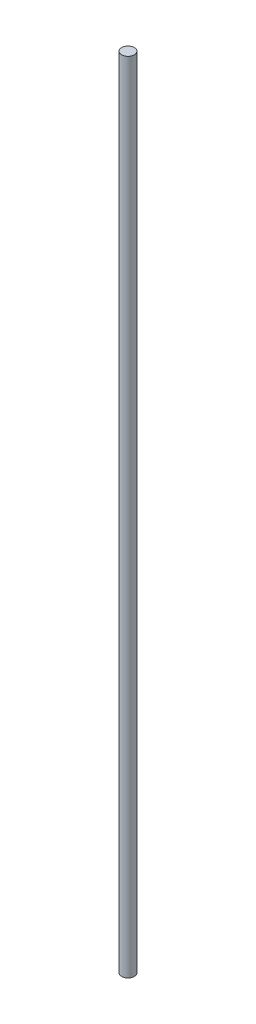
from build123d import *

# Parameters (mm, degrees)
SKETCH1_R           = 3.175
BOSS_EXTRUDE1_DEPTH = 400


with BuildPart() as part:
    # Sketch1 → Boss-Extrude1 (new body)
    with BuildSketch(Plane(origin=(0, 0, 0), x_dir=(1, 0, 0), z_dir=(0, 1, 0))):
        Circle(SKETCH1_R)
    extrude(amount=BOSS_EXTRUDE1_DEPTH)


solid = part.part
